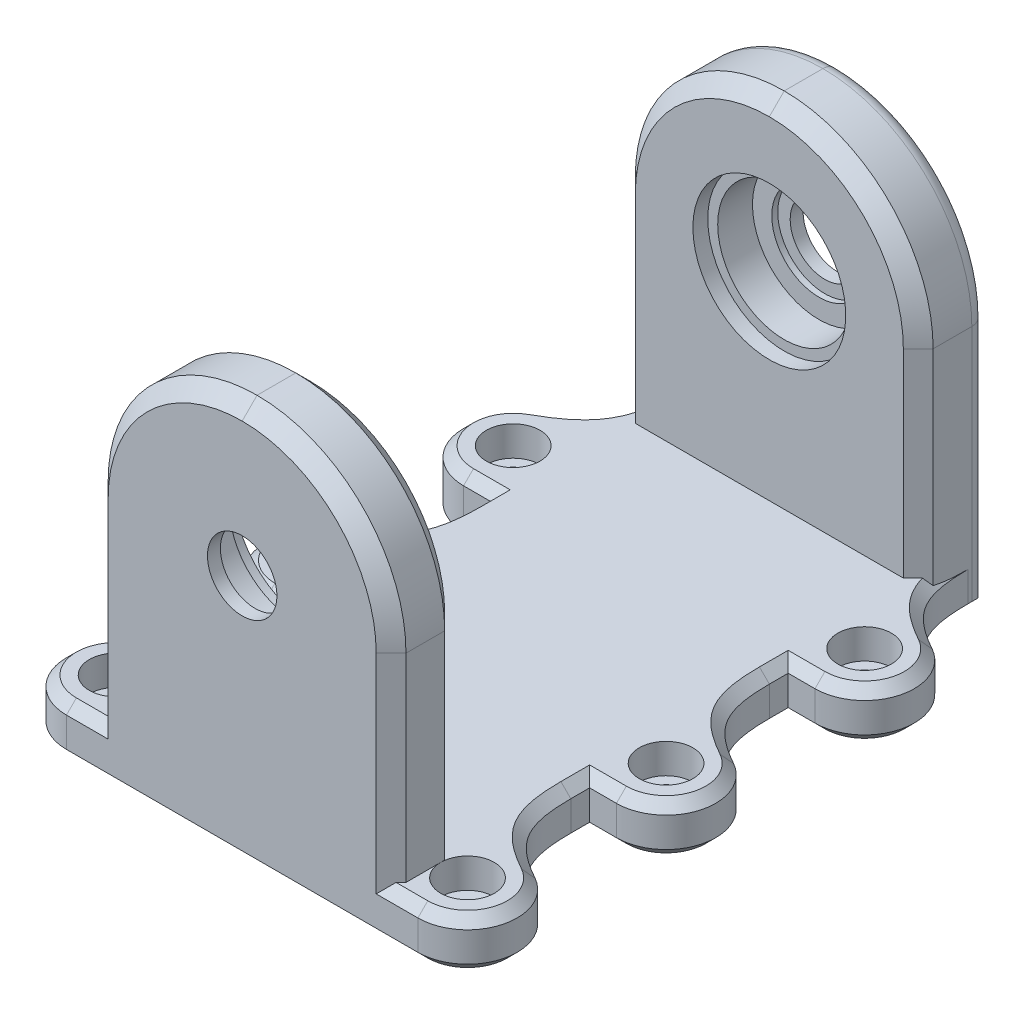
from build123d import *

# Parameters (mm, degrees)
SKETCH1_W           = 30
SKETCH1_H           = 60
BOSS_EXTRUDE1_DEPTH = 5
SKETCH3_R           = 3.5
BOSS_EXTRUDE2_DEPTH = 6.9
SKETCH4_R           = 7.7
CUT_EXTRUDE1_DEPTH  = 1.5
SKETCH6_R           = 6.7
CUT_EXTRUDE2_DEPTH  = 3.5
SKETCH9_R           = 4.75
CUT_EXTRUDE4_DEPTH  = 0.6
FILLET1_R           = 15
SKETCH11_R          = 1.6
BOSS_EXTRUDE3_DEPTH = 5
FILLET2_DEPTH       = 5
CHAMFER1_SIZE       = 1
SKETCH12_R          = 1.45
CUT_EXTRUDE5_DEPTH  = 4
CHAMFER2_SIZE       = 0.6
SKETCH13_R          = 2.7
CUT_EXTRUDE6_DEPTH  = 3
CHAMFER3_SIZE       = 1.5
FILLET3_R           = 1.5


with BuildPart() as part:
    # Sketch1 → Boss-Extrude1 (new body)
    with BuildSketch(Plane(origin=(0, 0, 0), x_dir=(1, 0, 0), z_dir=(0, 1, 0))):
        Rectangle(SKETCH1_W, SKETCH1_H)
    extrude(amount=BOSS_EXTRUDE1_DEPTH)

    # Sketch3 → Boss-Extrude2 (add)
    with BuildSketch(Plane.XY.offset(30)):
        Polygon((-15, 5), (15, 5), (15, 25), (15, 40), (-15, 40), (-15, 25), align=None)
        with Locations((0, 25)):
            Circle(SKETCH3_R, mode=Mode.SUBTRACT)
    boss_extrude2 = extrude(amount=-BOSS_EXTRUDE2_DEPTH)

    # Sketch4 → Cut-Extrude1 (cut)
    with BuildSketch(Plane(origin=(0, 0, 23.1), x_dir=(-1, 0, 0), z_dir=(0, 0, -1))):
        with Locations((0, 25)):
            Circle(SKETCH4_R)
    cut_extrude1 = extrude(amount=-CUT_EXTRUDE1_DEPTH, mode=Mode.SUBTRACT)

    # Sketch6 → Cut-Extrude2 (cut)
    with BuildSketch(Plane(origin=(0, 0, 24.6), x_dir=(-1, 0, 0), z_dir=(0, 0, -1))):
        with Locations((0, 25)):
            Circle(SKETCH6_R)
    cut_extrude2 = extrude(amount=-CUT_EXTRUDE2_DEPTH, mode=Mode.SUBTRACT)

    # Sketch9 → Cut-Extrude4 (cut)
    with BuildSketch(Plane(origin=(0, 0, 28.1), x_dir=(-1, 0, 0), z_dir=(0, 0, -1))):
        with Locations((0, 25)):
            Circle(SKETCH9_R)
    cut_extrude4 = extrude(amount=-CUT_EXTRUDE4_DEPTH, mode=Mode.SUBTRACT)

    # Mirror2: Boss-Extrude2, Cut-Extrude1, Cut-Extrude2, Cut-Extrude4 across plane
    add(boss_extrude2.mirror(Plane.XY))
    add(cut_extrude1.mirror(Plane.XY), mode=Mode.SUBTRACT)
    add(cut_extrude2.mirror(Plane.XY), mode=Mode.SUBTRACT)
    add(cut_extrude4.mirror(Plane.XY), mode=Mode.SUBTRACT)

    # Fillet1
    fillet1_edges = [part.edges().sort_by_distance(p)[0] for p in [
        (-15, 40, -26.55),
        (15, 40, -26.55),
        (-15, 40, 26.55),
        (15, 40, 26.55),
    ]]
    fillet(fillet1_edges, radius=FILLET1_R - 0.0001)  # a hair under: the kernel refuses the full size

    # Sketch11 → Boss-Extrude3 (add)
    # profile 1 of 6: a face of its own
    with BuildSketch(Plane(origin=(0, 0, 0), x_dir=(1, 0, 0), z_dir=(0, 1, 0))):
        with BuildLine():
            Line((17.7, -20), (15, -20))
            Line((15, -20), (15, -30))
            Line((15, -30), (17.7, -30))
            ThreePointArc((17.7, -30), (22.7, -25), (17.7, -20))
        make_face()
        with Locations(Location((17.7, -25, 0), (0, 0, 270))):
            Circle(SKETCH11_R, mode=Mode.SUBTRACT)
    # profile 2 of 6: a face of its own
    with BuildSketch(Plane(origin=(0, 0, 0), x_dir=(1, 0, 0), z_dir=(0, 1, 0))):
        with BuildLine():
            Line((-15, 20), (-15, 10))
            Line((-15, 10), (-17.7, 10))
            ThreePointArc((-17.7, 10), (-22.7, 15), (-17.7, 20))
            Line((-17.7, 20), (-15, 20))
        make_face()
        with Locations(Location((-17.7, 15, 0), (0, 0, 90))):
            Circle(SKETCH11_R, mode=Mode.SUBTRACT)
    # profile 3 of 6: a face of its own
    with BuildSketch(Plane(origin=(0, 0, 0), x_dir=(1, 0, 0), z_dir=(0, 1, 0))):
        with BuildLine():
            Line((15, -10), (17.7, -10))
            ThreePointArc((17.7, -10), (22.7, -5), (17.7, 0))
            Line((17.7, 0), (15, 0))
            Line((15, 0), (15, -10))
        make_face()
        with Locations(Location((17.7, -5, 0), (0, 0, 270))):
            Circle(SKETCH11_R, mode=Mode.SUBTRACT)
    # profile 4 of 6: a face of its own
    with BuildSketch(Plane(origin=(0, 0, 0), x_dir=(1, 0, 0), z_dir=(0, 1, 0))):
        with BuildLine():
            Line((15, 10), (17.7, 10))
            ThreePointArc((17.7, 10), (22.7, 15), (17.7, 20))
            Line((17.7, 20), (15, 20))
            Line((15, 20), (15, 10))
        make_face()
        with Locations(Location((17.7, 15, 0), (0, 0, 270))):
            Circle(SKETCH11_R, mode=Mode.SUBTRACT)
    # profile 5 of 6: a face of its own
    with BuildSketch(Plane(origin=(0, 0, 0), x_dir=(1, 0, 0), z_dir=(0, 1, 0))):
        with BuildLine():
            Line((-15, 0), (-15, -10))
            Line((-15, -10), (-17.7, -10))
            ThreePointArc((-17.7, -10), (-22.7, -5), (-17.7, 0))
            Line((-17.7, 0), (-15, 0))
        make_face()
        with Locations(Location((-17.7, -5, 0), (0, 0, 90))):
            Circle(SKETCH11_R, mode=Mode.SUBTRACT)
    # profile 6 of 6: a face of its own
    with BuildSketch(Plane(origin=(0, 0, 0), x_dir=(1, 0, 0), z_dir=(0, 1, 0))):
        with BuildLine():
            Line((-15, -20), (-15, -30))
            Line((-15, -30), (-17.7, -30))
            ThreePointArc((-17.7, -30), (-22.7, -25), (-17.7, -20))
            Line((-17.7, -20), (-15, -20))
        make_face()
        with Locations(Location((-17.7, -25, 0), (0, 0, 90))):
            Circle(SKETCH11_R, mode=Mode.SUBTRACT)
    extrude(amount=BOSS_EXTRUDE3_DEPTH)

    # Fillet2: read off the stored shape, not the designer's step
    # Fillet2 outline → Fillet2 (add)
    with BuildSketch(Plane(origin=(0, 0, 0), x_dir=(1, 0, 0), z_dir=(0, 1, 0))):
        with BuildLine():
            ThreePointArc((17.7, 20), (18.957041421, 19.839405631), (20.133333333, 19.367938746))
            add(Edge.make_bspline(
                [(20.133333333, 19.367938746), (15, 22.227665459), (15, 28.103816238)],
                knots=[0, 0, 0, 1, 1, 1], degree=2, weights=[1, 1.436946351, 1]))
            Line((15, 28.103816238), (15, 20))
            Line((15, 20), (17.7, 20))
        make_face()
        with BuildLine():
            ThreePointArc((17.7, 0), (18.957041421, -0.160594369), (20.133333333, -0.632061254))
            add(Edge.make_bspline(
                [(20.133333333, -0.632061254), (15, 2.227665459), (15, 8.103816238)],
                knots=[0, 0, 0, 1, 1, 1], degree=2, weights=[1, 1.436946351, 1]))
            Line((15, 8.103816238), (15, 0))
            Line((15, 0), (17.7, 0))
        make_face()
        with BuildLine():
            ThreePointArc((17.7, -20), (18.957041421, -20.160594369), (20.133333333, -20.632061254))
            add(Edge.make_bspline(
                [(20.133333333, -20.632061254), (15, -17.772334541), (15, -11.896183762)],
                knots=[0, 0, 0, 1, 1, 1], degree=2, weights=[1, 1.436946351, 1]))
            Line((15, -11.896183762), (15, -20))
            Line((15, -20), (17.7, -20))
        make_face()
        with BuildLine():
            Line((-15, 20), (-15, 28.103816238))
            add(Edge.make_bspline(
                [(-15, 28.103816238), (-15, 22.227665459), (-20.133333333, 19.367938746)],
                knots=[0, 0, 0, 1, 1, 1], degree=2, weights=[1, 1.436946351, 1]))
            ThreePointArc((-20.133333333, 19.367938746), (-18.957041421, 19.839405631), (-17.7, 20))
            Line((-17.7, 20), (-15, 20))
        make_face()
        with BuildLine():
            Line((-15, 0), (-15, 8.103816238))
            add(Edge.make_bspline(
                [(-15, 8.103816238), (-15, 2.227665459), (-20.133333333, -0.632061254)],
                knots=[0, 0, 0, 1, 1, 1], degree=2, weights=[1, 1.436946351, 1]))
            ThreePointArc((-20.133333333, -0.632061254), (-18.957041421, -0.160594369), (-17.7, 0))
            Line((-17.7, 0), (-15, 0))
        make_face()
        with BuildLine():
            Line((-15, -20), (-15, -11.896183762))
            add(Edge.make_bspline(
                [(-15, -11.896183762), (-15, -17.772334541), (-20.133333333, -20.632061254)],
                knots=[0, 0, 0, 1, 1, 1], degree=2, weights=[1, 1.436946351, 1]))
            ThreePointArc((-20.133333333, -20.632061254), (-18.957041421, -20.160594369), (-17.7, -20))
            Line((-17.7, -20), (-15, -20))
        make_face()
    extrude(amount=FILLET2_DEPTH)

    # Chamfer1
    chamfer1_edges = [part.edges().sort_by_distance(p)[0] for p in [
        (-15, 0, -9.051908119),
        (-15, 0, 10.948091881),
        (-15, 5, -9.051908119),
        (-15, 5, 10.948091881),
        (-16.35, 5, 30),
        (-16.35, 5, -10),
        (16.35, 0, 10),
        (16.35, 5, 10),
        (16.35, 5, -10),
        (-16.35, 0, 10),
        (-16.35, 5, 10),
        (16.35, 5, 30),
        (15, 0, -29.051908119),
        (15, 0, -9.051908119),
        (15, 5, -9.051908119),
        (15, 5, 10.948091881),
        (15, 0, 10.948091881),
        (0, 0, 30),
    ]]
    chamfer(chamfer1_edges, length=CHAMFER1_SIZE)

    # Sketch12 → Cut-Extrude5 (cut)
    with BuildSketch(Plane(origin=(0, 0, -30), x_dir=(-1, 0, 0), z_dir=(0, 0, -1))):
        with Locations((-9.525, 25)):
            Circle(SKETCH12_R)
        with Locations((9.525, 25)):
            Circle(SKETCH12_R)
    extrude(amount=-CUT_EXTRUDE5_DEPTH, mode=Mode.SUBTRACT)

    # Chamfer2
    chamfer2_edges = [part.edges().sort_by_distance(p)[0] for p in [
        (10.975, 25, -30),
        (-8.075, 25, -30),
    ]]
    chamfer(chamfer2_edges, length=CHAMFER2_SIZE)

    # Sketch13 → Cut-Extrude6 (cut)
    with BuildSketch(Plane(origin=(0, 5, 0), x_dir=(1, 0, 0), z_dir=(0, 1, 0))):
        with Locations(Location((-17.7, 15, 0), (0, 0, 270))):
            Circle(SKETCH13_R)
        with Locations(Location((17.7, 15, 0), (0, 0, 270))):
            Circle(SKETCH13_R)
        with Locations(Location((17.7, -5, 0), (0, 0, 270))):
            Circle(SKETCH13_R)
        with Locations(Location((17.7, -25, 0), (0, 0, 270))):
            Circle(SKETCH13_R)
        with Locations(Location((-17.7, -25, 0), (0, 0, 270))):
            Circle(SKETCH13_R)
        with Locations(Location((-17.7, -5, 0), (0, 0, 270))):
            Circle(SKETCH13_R)
    extrude(amount=-CUT_EXTRUDE6_DEPTH, mode=Mode.SUBTRACT)

    # Chamfer3
    chamfer3_edges = [part.edges().sort_by_distance(p)[0] for p in [
        (15, 15.00005, 23.1),
        (15, 14.910538174, -23.1),
        (15, 14.50005, 30),
        (-15, 14.50005, 30),
        (-10.606631007, 35.606631007, 30),
        (10.606631007, 35.606631007, 30),
        (-15, 15.00005, 23.1),
        (-10.606631007, 35.606631007, 23.1),
        (10.606631007, 35.606631007, 23.1),
        (-15, 14.910538174, -23.1),
        (-10.606631007, 35.606631007, -23.1),
        (10.606631007, 35.606631007, -23.1),
    ]]
    chamfer(chamfer3_edges, length=CHAMFER3_SIZE)

    # Fillet3
    fillet3_edges = [part.edges().sort_by_distance(p)[0] for p in [
        (15, 13.00005, -30),
        (10.606631007, 35.606631007, -30),
        (-10.606631007, 35.606631007, -30),
        (-15, 12.50005, -30),
    ]]
    fillet(fillet3_edges, radius=FILLET3_R)


solid = part.part
